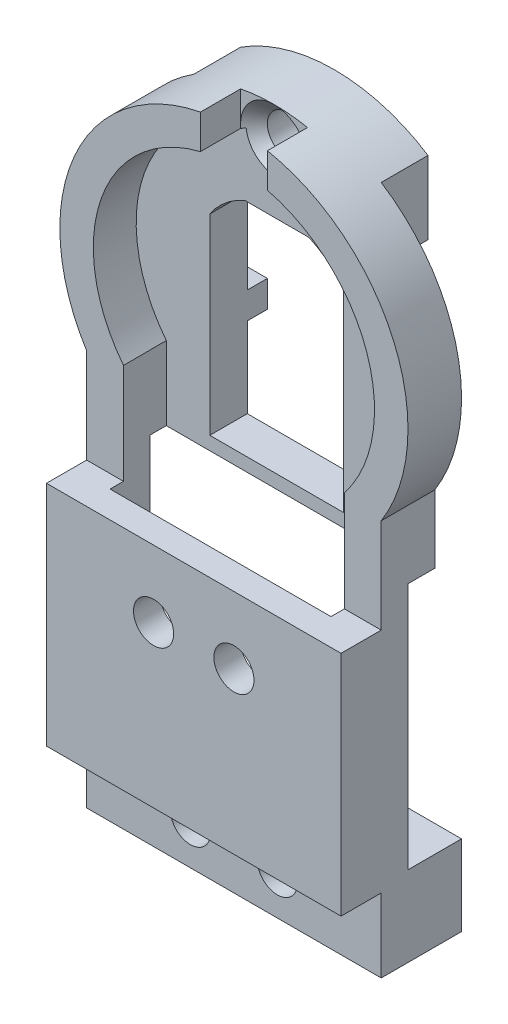
from build123d import *
from build123d.topology import SkipClean

# Parameters (mm, degrees)
SZKIC1_R                     = 12
SZKIC1_R_2                   = 6
DODANIE_WYCI_GNI_CIE1_DEPTH  = 2
SZKIC3_W                     = 22
SZKIC3_H                     = 32
DODANIE_WYCI_GNI_CIE2_DEPTH  = 2
SZKIC4_W                     = 22
SZKIC4_H                     = 6
DODANIE_WYCI_GNI_CIE3_DEPTH  = 4
SZKIC5_R                     = 1.5
WYTNIJ_WYCI_GNI_CIE1_DEPTH   = 6
SZKIC6_W                     = 10
SZKIC6_H                     = 1
DODANIE_WYCI_GNI_CIE4_DEPTH  = 4
DODANIE_WYCI_GNI_CIE5_START  = 4
DODANIE_WYCI_GNI_CIE5_DEPTH  = 4
DODANIE_WYCI_GNI_CIE6_START  = 4
DODANIE_WYCI_GNI_CIE6_DEPTH  = 4
SZKIC12_R                    = 13
SZKIC12_R_2                  = 8.25
DODANIE_WYCI_GNI_CIE7_DEPTH  = 2
SZKIC13_R                    = 8.25
WYTNIJ_WYCI_GNI_CIE5_DEPTH   = 2
DODANIE_WYCI_GNI_CIE8_DEPTH  = 4
DODANIE_WYCI_GNI_CIE9_START  = -4
DODANIE_WYCI_GNI_CIE9_DEPTH  = 5.5
SZKIC16_W                    = 5
SZKIC16_H                    = 8.571884582
WYTNIJ_WYCI_GNI_CIE6_DEPTH   = 3
SZKIC17_R                    = 1.5
WYTNIJ_WYCI_GNI_CIE7_DEPTH   = 5.5
SZKIC18_R                    = 8.25
WYTNIJ_WYCI_GNI_CIE8_DEPTH   = 1
SZKIC19_W                    = 2
SZKIC19_H                    = 2
DODANIE_WYCI_GNI_CIE10_DEPTH = 1.5
WYTNIJ_WYCI_GNI_CIE9_START   = -3
SZKIC20_R                    = 10.5
WYTNIJ_WYCI_GNI_CIE9_DEPTH   = 3
SZKIC21_W                    = 16.5
SZKIC21_H                    = 17
WYTNIJ_WYCI_GNI_CIE10_DEPTH  = 3
SZKIC22_W                    = 22
SZKIC22_H                    = 17
DODANIE_WYCI_GNI_CIE11_DEPTH = 3
SZKIC24_R                    = 1.5
WYTNIJ_WYCI_GNI_CIE11_DEPTH  = 3
SFAZOWANIE1_SIZE             = 1
DODANIE_WYCI_GNI_CIE14_START = 1
DODANIE_WYCI_GNI_CIE14_DEPTH = 1
DODANIE_WYCI_GNI_CIE15_START = 1
DODANIE_WYCI_GNI_CIE15_DEPTH = 1
SZKIC30_W                    = 2.75
SZKIC30_H                    = 5.506367645
DODANIE_WYCI_GNI_CIE16_DEPTH = 1
DODANIE_WYCI_GNI_CIE17_START = 1
DODANIE_WYCI_GNI_CIE17_DEPTH = 1
SZKIC32_W                    = 2.75
SZKIC32_H                    = 5.07179677
DODANIE_WYCI_GNI_CIE18_DEPTH = 1
SZKIC33_W                    = 16.5
SZKIC33_H                    = 9.5
WYTNIJ_WYCI_GNI_CIE12_DEPTH  = 1
WYTNIJ_WYCI_GNI_CIE13_START  = -0.2
WYTNIJ_WYCI_GNI_CIE13_DEPTH  = 0.2


with BuildPart() as part:
    # Szkic1 → Dodanie-wyciągnięcie1 (new body)
    with BuildSketch(Plane.XY):
        Circle(SZKIC1_R)
        Circle(SZKIC1_R_2, mode=Mode.SUBTRACT)
    extrude(amount=DODANIE_WYCI_GNI_CIE1_DEPTH)

    # Szkic3 → Dodanie-wyciągnięcie2 (add)
    with BuildSketch(Plane.XY.offset(2)):
        with Locations((0, -20.5)):
            Rectangle(SZKIC3_W, SZKIC3_H)
    extrude(amount=-DODANIE_WYCI_GNI_CIE2_DEPTH)

    # Szkic4 → Dodanie-wyciągnięcie3 (add)
    with BuildSketch(Plane(origin=(0, 0, 0), x_dir=(-1, 0, 0), z_dir=(0, 0, -1))):
        with Locations((0, -33.5)):
            Rectangle(SZKIC4_W, SZKIC4_H)
    extrude(amount=DODANIE_WYCI_GNI_CIE3_DEPTH)

    # Szkic5 → Wytnij-wyciągnięcie1 (cut)
    with BuildSketch(Plane.XY.offset(2)):
        with Locations((-3.25, -33.5)):
            Circle(SZKIC5_R)
        with Locations((3.25, -33.5)):
            Circle(SZKIC5_R)
    extrude(amount=-WYTNIJ_WYCI_GNI_CIE1_DEPTH, mode=Mode.SUBTRACT)

    # Szkic6 → Dodanie-wyciągnięcie4 (add)
    with BuildSketch(Plane(origin=(0, 0, 0), x_dir=(-1, 0, 0), z_dir=(0, 0, -1))):
        with Locations((0, -11.5)):
            Rectangle(SZKIC6_W, SZKIC6_H)
    extrude(amount=DODANIE_WYCI_GNI_CIE4_DEPTH)

    # Szkic7 → Dodanie-wyciągnięcie5 (add)
    with BuildSketch(Plane(origin=(0, 0, 0), x_dir=(-1, 0, 0), z_dir=(0, 0, -1)).offset(DODANIE_WYCI_GNI_CIE5_START)):
        with BuildLine():
            Line((-5, 8.5), (-5, 5.5))
            Line((-5, 5.5), (-5, 3.31662479))
            ThreePointArc((-5, 3.31662479), (0, 6), (5, 3.31662479))
            Line((5, 3.31662479), (5, 5.5))
            Line((5, 5.5), (5, 8.5))
            Line((5, 8.5), (-5, 8.5))
        make_face()
    extrude(amount=-DODANIE_WYCI_GNI_CIE5_DEPTH)

    # Szkic9 → Dodanie-wyciągnięcie6 (add)
    with BuildSketch(Plane(origin=(0, 0, 0), x_dir=(-1, 0, 0), z_dir=(0, 0, -1)).offset(DODANIE_WYCI_GNI_CIE6_START)):
        with BuildLine():
            Line((-7, 8.5), (-7, 9.746794345))
            ThreePointArc((-7, 9.746794345), (0, 12), (7, 9.746794345))
            Line((7, 9.746794345), (7, 8.5))
            Line((7, 8.5), (7, -12))
            Line((7, -12), (5, -12))
            Line((5, -12), (5, 8.5))
            Line((5, 8.5), (-5, 8.5))
            Line((-5, 8.5), (-5, -12))
            Line((-5, -12), (-7, -12))
            Line((-7, -12), (-7, 8.5))
        make_face()
    extrude(amount=-DODANIE_WYCI_GNI_CIE6_DEPTH)

    # Szkic12 → Dodanie-wyciągnięcie7 (add)
    with BuildSketch(Plane.XY.offset(2)):
        Circle(SZKIC12_R)
        Circle(SZKIC12_R_2, mode=Mode.SUBTRACT)
    extrude(amount=-DODANIE_WYCI_GNI_CIE7_DEPTH)

    # Szkic13 → Wytnij-wyciągnięcie5 (cut)
    with BuildSketch(Plane.XY.offset(2)):
        Circle(SZKIC13_R)
    extrude(amount=-WYTNIJ_WYCI_GNI_CIE5_DEPTH, mode=Mode.SUBTRACT)

    # Szkic14 → Dodanie-wyciągnięcie8 (add)
    with BuildSketch(Plane(origin=(0, 0, 0), x_dir=(-1, 0, 0), z_dir=(0, 0, -1))):
        with BuildLine():
            Line((-7, 10.95445115), (-7, 9.746794345))
            ThreePointArc((-7, 9.746794345), (0, 12), (7, 9.746794345))
            Line((7, 9.746794345), (7, 10.95445115))
            ThreePointArc((7, 10.95445115), (0, 13), (-7, 10.95445115))
        make_face()
    extrude(amount=DODANIE_WYCI_GNI_CIE8_DEPTH)

    # Szkic15 → Dodanie-wyciągnięcie9 (add)
    with BuildSketch(Plane(origin=(0, 0, -4), x_dir=(-1, 0, 0), z_dir=(0, 0, -1)).offset(DODANIE_WYCI_GNI_CIE9_START)):
        with BuildLine():
            Line((-7, 5.5), (7, 5.5))
            Line((7, 5.5), (7, 10.95445115))
            ThreePointArc((7, 10.95445115), (0, 13), (-7, 10.95445115))
            Line((-7, 10.95445115), (-7, 5.5))
        make_face()
    extrude(amount=DODANIE_WYCI_GNI_CIE9_DEPTH)

    # Szkic16 → Wytnij-wyciągnięcie6 (cut)
    with BuildSketch(Plane.XY.offset(2)):
        with Locations((0, 10.229933778)):
            Rectangle(SZKIC16_W, SZKIC16_H)
    extrude(amount=-WYTNIJ_WYCI_GNI_CIE6_DEPTH, mode=Mode.SUBTRACT)

    # Szkic17 → Wytnij-wyciągnięcie7 (cut)
    with BuildSketch(Plane.XY):
        with Locations((0, 10.5)):
            Circle(SZKIC17_R)
    extrude(amount=-WYTNIJ_WYCI_GNI_CIE7_DEPTH, mode=Mode.SUBTRACT)

    # Szkic18 → Wytnij-wyciągnięcie8 (cut)
    with BuildSketch(Plane.XY):
        Circle(SZKIC18_R)
    extrude(amount=-WYTNIJ_WYCI_GNI_CIE8_DEPTH, mode=Mode.SUBTRACT)

    # Szkic19 → Dodanie-wyciągnięcie10 (add)
    with BuildSketch(Plane(origin=(0, 0, -4), x_dir=(-1, 0, 0), z_dir=(0, 0, -1))):
        with Locations((-6, -4)):
            Rectangle(SZKIC19_W, SZKIC19_H)
    dodanie_wyci_gni_cie10 = extrude(amount=DODANIE_WYCI_GNI_CIE10_DEPTH)

    # Lustro1: Dodanie-wyciągnięcie10 across plane
    add(dodanie_wyci_gni_cie10.mirror(Plane(origin=(0, 0, 0), x_dir=(0, 0, 1), z_dir=(1, 0, 0))))

    # Szkic20 → Wytnij-wyciągnięcie9 (cut)
    with BuildSketch(Plane.XY.offset(2).offset(WYTNIJ_WYCI_GNI_CIE9_START)):
        Circle(SZKIC20_R)
    extrude(amount=WYTNIJ_WYCI_GNI_CIE9_DEPTH, mode=Mode.SUBTRACT)

    # Szkic21 → Wytnij-wyciągnięcie10 (cut)
    with BuildSketch(Plane.XY.offset(2)):
        with Locations((0, -15)):
            Rectangle(SZKIC21_W, SZKIC21_H)
    extrude(amount=-WYTNIJ_WYCI_GNI_CIE10_DEPTH, mode=Mode.SUBTRACT)

    # Szkic22 → Dodanie-wyciągnięcie11 (add)
    with BuildSketch(Plane.XY.offset(2)):
        with Locations((0, -22.5)):
            Rectangle(SZKIC22_W, SZKIC22_H)
    extrude(amount=DODANIE_WYCI_GNI_CIE11_DEPTH)

    # Szkic24 → Wytnij-wyciągnięcie11 (cut)
    with BuildSketch(Plane.XY.offset(5)):
        with Locations((-3, -19)):
            Circle(SZKIC24_R)
        with Locations((3, -19)):
            Circle(SZKIC24_R)
    extrude(amount=-WYTNIJ_WYCI_GNI_CIE11_DEPTH, mode=Mode.SUBTRACT)

    # Sfazowanie1
    sfazowanie1_edges = [part.edges().sort_by_distance(p)[0] for p in [
        (-1.5, 10.5, -1),
    ]]
    chamfer(sfazowanie1_edges, length=SFAZOWANIE1_SIZE - 0.0001)  # a hair under: the kernel refuses the full size

    # Szkic27 → Dodanie-wyciągnięcie14 (add)
    with SkipClean():  # the faces are left unmerged after this step: merging them gives an invalid solid
        with BuildSketch(Plane(origin=(0, 0, 0), x_dir=(-1, 0, 0), z_dir=(0, 0, -1)).offset(DODANIE_WYCI_GNI_CIE14_START)):
            with BuildLine():
                Line((-7, 7.826237921), (-7, 10.95445115))
                ThreePointArc((-7, 10.95445115), (-12.977033627, 0.772397723), (-8.25, -10.046765649))
                Line((-8.25, -10.046765649), (-8.25, -6.495190528))
                ThreePointArc((-8.25, -6.495190528), (-10.460231986, 0.912987837), (-7, 7.826237921))
            make_face()
            with BuildLine():
                Line((7, 7.826237921), (7, 10.95445115))
                ThreePointArc((7, 10.95445115), (12.977033627, 0.772397723), (8.25, -10.046765649))
                Line((8.25, -10.046765649), (8.25, -6.495190528))
                ThreePointArc((8.25, -6.495190528), (10.460231986, 0.912987837), (7, 7.826237921))
            make_face()
        extrude(amount=-DODANIE_WYCI_GNI_CIE14_DEPTH)

    # Szkic29 → Dodanie-wyciągnięcie15 (add)
    with SkipClean():  # the faces are left unmerged after this step: merging them gives an invalid solid
        with BuildSketch(Plane(origin=(0, 0, -1), x_dir=(-1, 0, 0), z_dir=(0, 0, -1)).offset(DODANIE_WYCI_GNI_CIE15_START)):
            with BuildLine():
                Line((11, -6.92820323), (11, -12))
                Line((11, -12), (5, -12))
                Line((5, -12), (5, -11))
                Line((5, -11), (5, 12))
                ThreePointArc((5, 12), (12.392304845, 3.92820323), (11, -6.92820323))
            make_face()
        extrude(amount=-DODANIE_WYCI_GNI_CIE15_DEPTH)

    # Szkic30 → Dodanie-wyciągnięcie16 (add)
    with SkipClean():  # the faces are left unmerged after this step: merging them gives an invalid solid
        with BuildSketch(Plane(origin=(0, 0, 0), x_dir=(-1, 0, 0), z_dir=(0, 0, -1))):
            with Locations((9.625, -9.246816178)):
                Rectangle(SZKIC30_W, SZKIC30_H)
        extrude(amount=DODANIE_WYCI_GNI_CIE16_DEPTH)

    # Szkic31 → Dodanie-wyciągnięcie17 (add)
    with SkipClean():  # the faces are left unmerged after this step: merging them gives an invalid solid
        with BuildSketch(Plane(origin=(0, 0, -1), x_dir=(-1, 0, 0), z_dir=(0, 0, -1)).offset(DODANIE_WYCI_GNI_CIE17_START)):
            with BuildLine():
                Line((-11, -12), (-5.939283137, -12))
                Line((-5.939283137, -12), (-5.939283137, -6.495190528))
                Line((-5.939283137, -6.495190528), (-5.939283137, 11.563948972))
                ThreePointArc((-5.939283137, 11.563948972), (-12.538929442, 3.431508187), (-11, -6.92820323))
                Line((-11, -6.92820323), (-11, -12))
            make_face()
        extrude(amount=-DODANIE_WYCI_GNI_CIE17_DEPTH)

    # Szkic32 → Dodanie-wyciągnięcie18 (add)
    with SkipClean():  # the faces are left unmerged after this step: merging them gives an invalid solid
        with BuildSketch(Plane(origin=(0, 0, 0), x_dir=(-1, 0, 0), z_dir=(0, 0, -1))):
            with Locations((-9.625, -9.464101615)):
                Rectangle(SZKIC32_W, SZKIC32_H)
        extrude(amount=DODANIE_WYCI_GNI_CIE18_DEPTH)

    # Szkic33 → Wytnij-wyciągnięcie12 (cut)
    with SkipClean():  # the faces are left unmerged after this step: merging them gives an invalid solid
        with BuildSketch(Plane(origin=(0, 0, 2), x_dir=(-1, 0, 0), z_dir=(0, 0, -1))):
            with Locations((0, -18.75)):
                Rectangle(SZKIC33_W, SZKIC33_H)
        extrude(amount=-WYTNIJ_WYCI_GNI_CIE12_DEPTH, mode=Mode.SUBTRACT)

    # Wytnij-wyciągnięcie13: read off the stored shape, not the designer's step
    # Wytnij-wyciągnięcie13 outline → Wytnij-wyciągnięcie13 (cut)
    with SkipClean():  # the faces are left unmerged after this step: merging them gives an invalid solid
        with BuildSketch(Plane.XY.offset(-1).offset(WYTNIJ_WYCI_GNI_CIE13_START)):
            with BuildLine():
                Line((-8.246211251, -6.5), (-8.25, -6.5))
                Line((-8.25, -6.5), (-8.25, -12))
                Line((-8.25, -12), (8.25, -12))
                Line((8.25, -12), (8.25, -6.5))
                Line((8.25, -6.5), (8.246211251, -6.5))
                ThreePointArc((8.246211251, -6.5), (9.892290104, 3.520311988), (2.286163597, 10.248095238))
                ThreePointArc((2.286163597, 10.248095238), (0, 8.2), (-2.286163597, 10.248095238))
                ThreePointArc((-2.286163597, 10.248095238), (-9.892290104, 3.520311988), (-8.246211251, -6.5))
            make_face()
            with BuildLine():
                Line((5, 3.31662479), (5, -11))
                Line((5, -11), (-5, -11))
                Line((-5, -11), (-5, 3.31662479))
                ThreePointArc((-5, 3.31662479), (-3.856691747, 4.596295113), (-2.397915762, 5.5))
                Line((-2.397915762, 5.5), (2.397915762, 5.5))
                ThreePointArc((2.397915762, 5.5), (3.856691747, 4.596295113), (5, 3.31662479))
            make_face(mode=Mode.SUBTRACT)
        extrude(amount=WYTNIJ_WYCI_GNI_CIE13_DEPTH, mode=Mode.SUBTRACT)


solid = part.part
